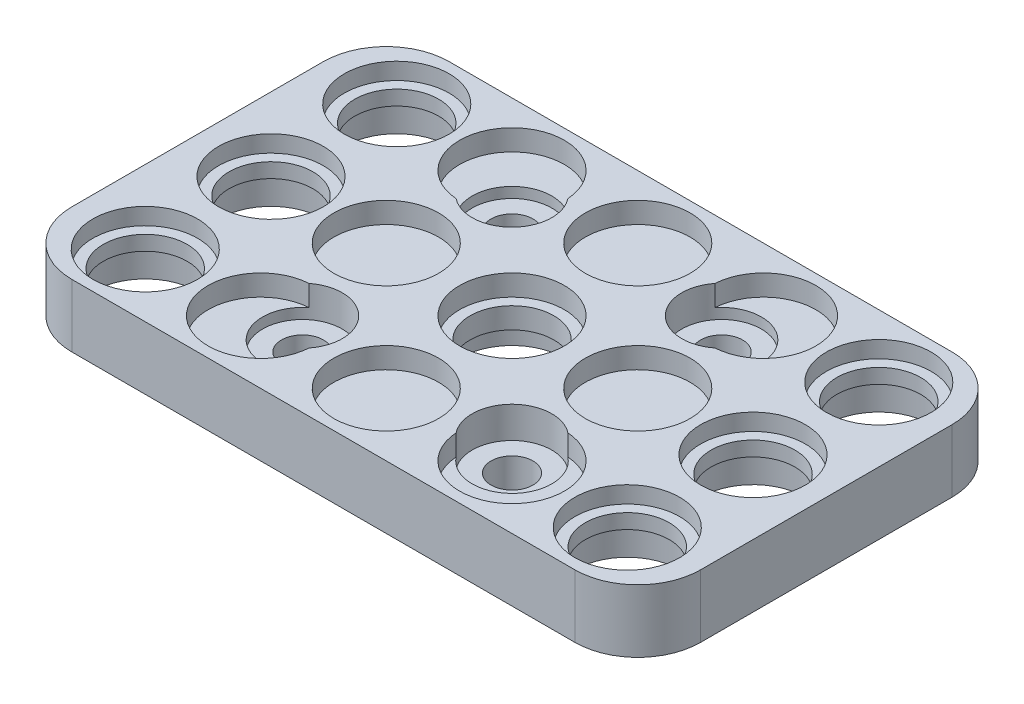
from build123d import *

# Parameters (mm, degrees)
BOSS_EXTRUDE1_DEPTH     = 3
HOLE2_AT_2_COUNT        = 2
HOLE2_AT_2_PITCH        = 6
HOLE2_AT_3_COUNT        = 2
HOLE2_AT_3_PITCH        = 12
HOLE3_OUTLINE_R         = 2.5
HOLE3_DEPTH             = 1.5
SKETCH8_R               = 2.5
CUT_EXTRUDE1_DEPTH      = 1
FILL_START              = 2
FILL_PATTERN2_OUTLINE_R = 2.5
FILL_PATTERN2_DEPTH     = 1
HOLE6_D                 = 4
HOLE6_DEPTH             = 1.5
HOLE6_CBORE_D           = 5
HOLE6_CBORE_DEPTH       = 1
HOLE6_TIP               = 1.201721238
HOLE7_D                 = 4
HOLE7_DEPTH             = 3
HOLE7_CBORE_D           = 5
HOLE7_CBORE_DEPTH       = 1
HOLE7_TIP               = 1.201721238
HOLE8_D                 = 2
HOLE8_DEPTH             = 3
HOLE8_CBORE_D           = 3.8
HOLE8_CBORE_DEPTH       = 1.5
HOLE8_TIP               = 0.600860619


# Read off the part's stored shape, not the designer's step: Hole3, Fill Pattern2
with BuildPart() as part:
    # Sketch1 → Boss-Extrude1 (new body)
    with BuildSketch(Plane(origin=(0, 0, 0), x_dir=(1, 0, 0), z_dir=(0, 1, 0))):
        with BuildLine():
            Line((-12, 9), (12, 9))
            ThreePointArc((12, 9), (14.121320344, 8.121320344), (15, 6))
            Line((15, 6), (15, -6))
            ThreePointArc((15, -6), (14.121320344, -8.121320344), (12, -9))
            Line((12, -9), (-12, -9))
            ThreePointArc((-12, -9), (-14.121320344, -8.121320344), (-15, -6))
            Line((-15, -6), (-15, 6))
            ThreePointArc((-15, 6), (-14.121320344, 8.121320344), (-12, 9))
        make_face()
    extrude(amount=BOSS_EXTRUDE1_DEPTH)

    # Sketch3 → Hole2 (revolve, cut)
    with BuildSketch(Plane(origin=(-11.5, 3, -6), x_dir=(0, 0, 1), z_dir=(1, 0, 0))):
        Polygon((0, 0), (0, 2.701721238), (2, 1.5), (2, 0.8), (2.5, 0.8), (2.5, 0), align=None)
    hole2 = revolve(axis=Axis((-11.5, 14.310875039, -6), (0, -1, 0)), mode=Mode.SUBTRACT)

    # Hole2 at 2: Hole2 ×2
    with Locations(*[(0, 0, i * HOLE2_AT_2_PITCH) for i in range(1, HOLE2_AT_2_COUNT)]):
        add(hole2, mode=Mode.SUBTRACT)

    # Hole2 at 3: Hole2 ×2
    with Locations(*[(0, 0, i * HOLE2_AT_3_PITCH) for i in range(1, HOLE2_AT_3_COUNT)]):
        add(hole2, mode=Mode.SUBTRACT)

    # Hole3 outline → Hole3 (cut)
    with BuildSketch(Plane(origin=(0, 0, 0), x_dir=(1, 0, 0), z_dir=(0, 1, 0))):
        with Locations((-11.5, -6)):
            Circle(HOLE3_OUTLINE_R)
        with Locations((-11.5, 0)):
            Circle(HOLE3_OUTLINE_R)
        with Locations((-11.5, 6)):
            Circle(HOLE3_OUTLINE_R)
    hole3 = extrude(amount=HOLE3_DEPTH, mode=Mode.SUBTRACT)

    # Mirror1: Hole2, Hole3 across plane
    add(hole2.mirror(Plane(origin=(0, 0, 0), x_dir=(0, 0, 1), z_dir=(1, 0, 0))), mode=Mode.SUBTRACT)
    add(hole3.mirror(Plane(origin=(0, 0, 0), x_dir=(0, 0, 1), z_dir=(1, 0, 0))), mode=Mode.SUBTRACT)

    # Mirror1 copy 1 sketch → Mirror1 copy 1 (revolve, cut)
    with BuildSketch(Plane(origin=(11.5, 3, 0), x_dir=(0, 0, 1), z_dir=(-1, 0, 0))):
        Polygon((0, 0), (0, -2.701721238), (2, -1.5), (2, -0.8), (2.5, -0.8), (2.5, 0), align=None)
    revolve(axis=Axis((11.5, 14.310875039, 0), (0, 1, 0)), mode=Mode.SUBTRACT)

    # Mirror1 copy 2 sketch → Mirror1 copy 2 (revolve, cut)
    with BuildSketch(Plane(origin=(11.5, 3, 6), x_dir=(0, 0, 1), z_dir=(-1, 0, 0))):
        Polygon((0, 0), (0, -2.701721238), (2, -1.5), (2, -0.8), (2.5, -0.8), (2.5, 0), align=None)
    revolve(axis=Axis((11.5, 14.310875039, 6), (0, 1, 0)), mode=Mode.SUBTRACT)

    # Sketch8 → Cut-Extrude1 (cut)
    with BuildSketch(Plane(origin=(0, 3, 0), x_dir=(1, 0, 0), z_dir=(0, 1, 0))):
        with Locations(Location((0, 0, 0), (0, 0, 270))):
            Circle(SKETCH8_R)
    extrude(amount=-CUT_EXTRUDE1_DEPTH, mode=Mode.SUBTRACT)

    # Fill Pattern2 outline → Fill Pattern2 (cut)
    with BuildSketch(Plane(origin=(0, 0, 0), x_dir=(1, 0, 0), z_dir=(0, 1, 0)).offset(FILL_START)):
        with Locations((-6, -6)):
            Circle(FILL_PATTERN2_OUTLINE_R)
        with Locations((0, -6)):
            Circle(FILL_PATTERN2_OUTLINE_R)
        with Locations((6, -6)):
            Circle(FILL_PATTERN2_OUTLINE_R)
        with Locations((6, 0)):
            Circle(FILL_PATTERN2_OUTLINE_R)
        with Locations((6, 6)):
            Circle(FILL_PATTERN2_OUTLINE_R)
        with Locations((0, 6)):
            Circle(FILL_PATTERN2_OUTLINE_R)
        with Locations((-6, 6)):
            Circle(FILL_PATTERN2_OUTLINE_R)
        with Locations((-6, 0)):
            Circle(FILL_PATTERN2_OUTLINE_R)
    extrude(amount=FILL_PATTERN2_DEPTH, mode=Mode.SUBTRACT)

    # Hole6
    with Locations(Plane(origin=(0, 3, 0), x_dir=(1, 0, 0), z_dir=(0, 1, 0))):
        with Locations((0, 0)):
            CounterBoreHole(HOLE6_D / 2, HOLE6_CBORE_D / 2, HOLE6_CBORE_DEPTH, depth=HOLE6_DEPTH)
            with Locations((0, 0, -(HOLE6_DEPTH + HOLE6_TIP / 2))):  # 118° drill point
                Cone(0, HOLE6_D / 2, HOLE6_TIP, mode=Mode.SUBTRACT)

    # Hole7
    with Locations(Plane(origin=(0, 0, 0), x_dir=(-1, 0, 0), z_dir=(0, -1, 0))):
        with Locations((0, 0)):
            CounterBoreHole(HOLE7_D / 2, HOLE7_CBORE_D / 2, HOLE7_CBORE_DEPTH, depth=HOLE7_DEPTH)
            with Locations((0, 0, -(HOLE7_DEPTH + HOLE7_TIP / 2))):  # 118° drill point
                Cone(0, HOLE7_D / 2, HOLE7_TIP, mode=Mode.SUBTRACT)

    # Hole8
    with Locations(Plane(origin=(0, 3, 0), x_dir=(1, 0, 0), z_dir=(0, 1, 0))):
        with Locations((-5, -5), (-5, 5), (5, 5), (5, -5)):
            CounterBoreHole(HOLE8_D / 2, HOLE8_CBORE_D / 2, HOLE8_CBORE_DEPTH, depth=HOLE8_DEPTH)
            with Locations((0, 0, -(HOLE8_DEPTH + HOLE8_TIP / 2))):  # 118° drill point
                Cone(0, HOLE8_D / 2, HOLE8_TIP, mode=Mode.SUBTRACT)


solid = part.part
